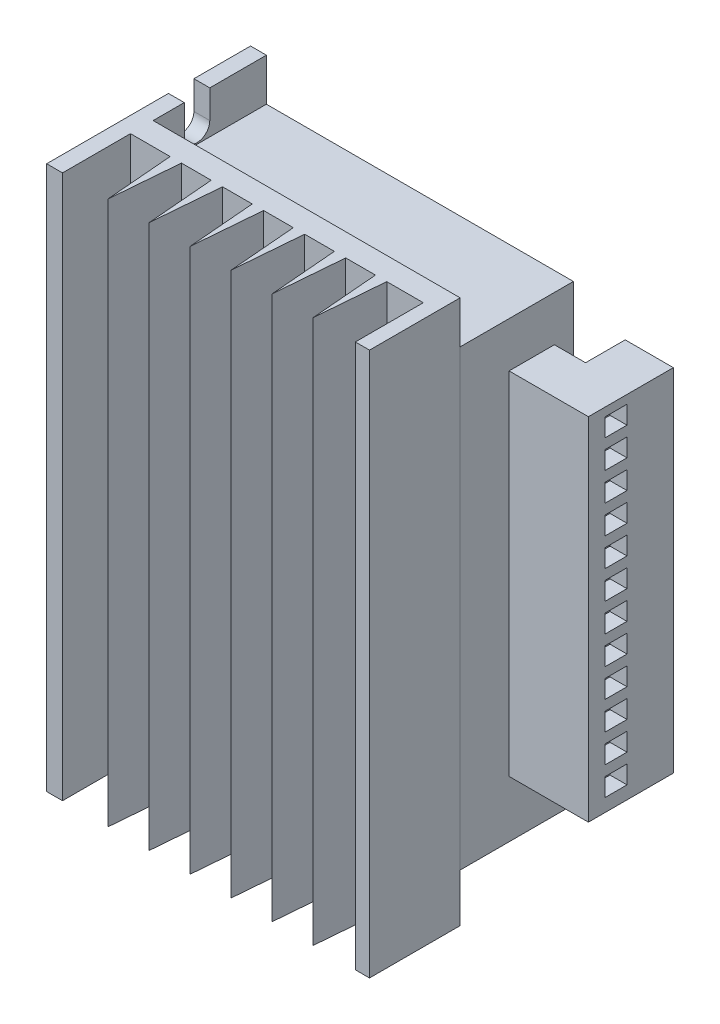
from build123d import *

# Parameters (mm, degrees)
BOSS_EXTRUDE1_DEPTH    = 96
SKETCH2_W              = 20
SKETCH2_H              = 80
BOSS_EXTRUDE2_DEPTH    = 54.2
CUT_EXTRUDE1_DEPTH     = 4
SKETCH9_W              = 8
SKETCH9_H              = 62
BOSS_EXTRUDE4_DEPTH    = 14
SKETCH10_W             = 15
SKETCH10_H             = 62
BOSS_EXTRUDE5_DEPTH    = 8.5
SKETCH11_R             = 1.6
CUT_EXTRUDE2_DEPTH     = 1
SKETCH13_R             = 1.508529724
BOSS_EXTRUDE6_DEPTH    = 0.5
BOSS_EXTRUDE6_2_DEPTH  = 0.5
BOSS_EXTRUDE6_3_DEPTH  = 0.5
BOSS_EXTRUDE6_4_DEPTH  = 0.5
BOSS_EXTRUDE6_5_DEPTH  = 0.5
BOSS_EXTRUDE6_6_DEPTH  = 0.5
BOSS_EXTRUDE6_7_DEPTH  = 0.5
BOSS_EXTRUDE6_8_DEPTH  = 0.5
BOSS_EXTRUDE6_9_DEPTH  = 0.5
BOSS_EXTRUDE6_10_DEPTH = 0.5
BOSS_EXTRUDE6_11_DEPTH = 0.5
BOSS_EXTRUDE6_12_DEPTH = 0.5
FILLET19_R             = 0.5
FILLET20_R             = 0.5
FILLET21_R             = 0.5
FILLET22_R             = 0.5
FILLET23_R             = 0.5
FILLET24_R             = 0.5
FILLET25_R             = 0.5
FILLET26_R             = 0.5
FILLET27_R             = 0.5
FILLET28_R             = 0.5
FILLET29_R             = 0.5
FILLET30_R             = 0.5
CUT_EXTRUDE4_DEPTH     = 0.25
SKETCH16_W             = 3.926204787
SKETCH16_H             = 3.2
CUT_EXTRUDE5_DEPTH     = 3


with BuildPart() as part:
    # Sketch1 → Boss-Extrude1 (new body)
    with BuildSketch(Plane(origin=(0, 0, 0), x_dir=(1, 0, 0), z_dir=(0, 1, 0))):
        Polygon((2.8, 16), (57, 16), (57, 0), (54.5, 0), (54.5, 12), (48.05, 12), (47.05, 0), (46.05, 12), (40.8, 12), (39.8, 0), (38.8, 12), (33.55, 12), (32.55, 0), (31.55, 12), (26.3, 12), (25.3, 0), (24.3, 12), (19.05, 12), (18.05, 0), (17.05, 12), (11.8, 12), (10.8, 0), (9.8, 12), (2.8, 12), (2.8, 0), (0, 0), (0, 36), (2.8, 36), align=None)
    extrude(amount=BOSS_EXTRUDE1_DEPTH)

    # Sketch8 → Cut-Extrude1 (cut)
    with BuildSketch(Plane(origin=(2.8, 0, 0), x_dir=(0, 0, -1), z_dir=(1, 0, 0))):
        with BuildLine():
            Line((26, 91), (26, 96))
            Line((26, 96), (21.5, 96))
            Line((21.5, 96), (21.5, 91))
            ThreePointArc((21.5, 91), (23.75, 88.75), (26, 91))
        make_face()
        with BuildLine():
            Line((21.5, 5), (21.5, 0))
            Line((21.5, 0), (26, 0))
            Line((26, 0), (26, 5))
            ThreePointArc((26, 5), (23.75, 7.25), (21.5, 5))
        make_face()
    extrude(amount=-CUT_EXTRUDE1_DEPTH, mode=Mode.SUBTRACT)


with BuildPart() as body_2:
    # Sketch2 → Boss-Extrude2 (new body)
    with BuildSketch(Plane(origin=(2.8, 0, 0), x_dir=(0, 0, -1), z_dir=(1, 0, 0))):
        with Locations((26, 48.5)):
            Rectangle(SKETCH2_W, SKETCH2_H)
    extrude(amount=BOSS_EXTRUDE2_DEPTH)


with BuildPart() as body_3:
    # Sketch9 → Boss-Extrude4 (new body)
    with BuildSketch(Plane(origin=(57, 0, 0), x_dir=(0, 0, -1), z_dir=(1, 0, 0))):
        with Locations((28.644699002, 49.5)):
            Rectangle(SKETCH9_W, SKETCH9_H)
    extrude(amount=BOSS_EXTRUDE4_DEPTH)

    # Sketch10 → Boss-Extrude5 (add)
    with BuildSketch(Plane(origin=(71, 0, 0), x_dir=(0, 0, -1), z_dir=(1, 0, 0))):
        with Locations((32.144699002, 49.5)):
            Rectangle(SKETCH10_W, SKETCH10_H)
    extrude(amount=-BOSS_EXTRUDE5_DEPTH)

    # Sketch11 → Cut-Extrude2 (cut)
    with BuildSketch(Plane(origin=(0, 0, -39.644699002), x_dir=(-1, 0, 0), z_dir=(0, 0, -1))):
        with Locations(Location((-66.124483919, 77.496806183, 0), (0, 0, 90))):
            Circle(SKETCH11_R)
        with Locations(Location((-66.124483919, 72.496806183, 0), (0, 0, 90))):
            Circle(SKETCH11_R)
        with Locations(Location((-66.124483919, 67.496806183, 0), (0, 0, 90))):
            Circle(SKETCH11_R)
        with Locations(Location((-66.124483919, 62.496806183, 0), (0, 0, 90))):
            Circle(SKETCH11_R)
        with Locations(Location((-66.124483919, 57.496806183, 0), (0, 0, 90))):
            Circle(SKETCH11_R)
        with Locations(Location((-66.124483919, 52.496806183, 0), (0, 0, 90))):
            Circle(SKETCH11_R)
        with Locations(Location((-66.124483919, 47.496806183, 0), (0, 0, 90))):
            Circle(SKETCH11_R)
        with Locations(Location((-66.124483919, 42.496806183, 0), (0, 0, 90))):
            Circle(SKETCH11_R)
        with Locations(Location((-66.124483919, 37.496806183, 0), (0, 0, 90))):
            Circle(SKETCH11_R)
        with Locations(Location((-66.124483919, 32.496806183, 0), (0, 0, 90))):
            Circle(SKETCH11_R)
        with Locations(Location((-66.124483919, 27.496806183, 0), (0, 0, 90))):
            Circle(SKETCH11_R)
        with Locations(Location((-66.124483919, 22.496806183, 0), (0, 0, 90))):
            Circle(SKETCH11_R)
    extrude(amount=-CUT_EXTRUDE2_DEPTH, mode=Mode.SUBTRACT)

    # Sketch16 → Cut-Extrude5 (cut)
    with BuildSketch(Plane(origin=(71, 0, 0), x_dir=(0, 0, -1), z_dir=(1, 0, 0))):
        with Locations((29.499003124, 77.4)):
            Rectangle(SKETCH16_W, SKETCH16_H)
        with Locations((29.499003124, 72.4)):
            Rectangle(SKETCH16_W, SKETCH16_H)
        with Locations((29.499003124, 67.4)):
            Rectangle(SKETCH16_W, SKETCH16_H)
        with Locations((29.499003124, 62.4)):
            Rectangle(SKETCH16_W, SKETCH16_H)
        with Locations((29.499003124, 57.4)):
            Rectangle(SKETCH16_W, SKETCH16_H)
        with Locations((29.499003124, 52.4)):
            Rectangle(SKETCH16_W, SKETCH16_H)
        with Locations((29.499003124, 47.4)):
            Rectangle(SKETCH16_W, SKETCH16_H)
        with Locations((29.499003124, 42.4)):
            Rectangle(SKETCH16_W, SKETCH16_H)
        with Locations((29.499003124, 37.4)):
            Rectangle(SKETCH16_W, SKETCH16_H)
        with Locations((29.499003124, 32.4)):
            Rectangle(SKETCH16_W, SKETCH16_H)
        with Locations((29.499003124, 27.4)):
            Rectangle(SKETCH16_W, SKETCH16_H)
        with Locations((29.499003124, 22.4)):
            Rectangle(SKETCH16_W, SKETCH16_H)
    extrude(amount=-CUT_EXTRUDE5_DEPTH, mode=Mode.SUBTRACT)


with BuildPart() as body_4:
    # Sketch13 → Boss-Extrude6 (new body)
    with BuildSketch(Plane(origin=(0, 0, -38.644699002), x_dir=(-1, 0, 0), z_dir=(0, 0, -1))):
        with Locations(Location((-66.124483919, 77.496806183, 0), (0, 0, 90))):
            Circle(SKETCH13_R)
    extrude(amount=BOSS_EXTRUDE6_DEPTH)

    # Fillet19
    fillet19_edges = [body_4.edges().sort_by_distance(p)[0] for p in [
        (66.124483919, 75.988276459, -39.144699002),
    ]]
    fillet(fillet19_edges, radius=FILLET19_R - 0.0001)  # a hair under: the kernel refuses the full size


with BuildPart() as body_5:
    # Sketch13 → Boss-Extrude6 2 (new body)
    with BuildSketch(Plane(origin=(0, 0, -38.644699002), x_dir=(-1, 0, 0), z_dir=(0, 0, -1))):
        with Locations(Location((-66.124483919, 72.496806183, 0), (0, 0, 90))):
            Circle(SKETCH13_R)
    extrude(amount=BOSS_EXTRUDE6_2_DEPTH)

    # Fillet20
    fillet20_edges = [body_5.edges().sort_by_distance(p)[0] for p in [
        (66.124483919, 70.988276459, -39.144699002),
    ]]
    fillet(fillet20_edges, radius=FILLET20_R - 0.0001)  # a hair under: the kernel refuses the full size


with BuildPart() as body_6:
    # Sketch13 → Boss-Extrude6 3 (new body)
    with BuildSketch(Plane(origin=(0, 0, -38.644699002), x_dir=(-1, 0, 0), z_dir=(0, 0, -1))):
        with Locations(Location((-66.124483919, 67.496806183, 0), (0, 0, 90))):
            Circle(SKETCH13_R)
    extrude(amount=BOSS_EXTRUDE6_3_DEPTH)

    # Fillet21
    fillet21_edges = [body_6.edges().sort_by_distance(p)[0] for p in [
        (66.124483919, 65.988276459, -39.144699002),
    ]]
    fillet(fillet21_edges, radius=FILLET21_R - 0.0001)  # a hair under: the kernel refuses the full size


with BuildPart() as body_7:
    # Sketch13 → Boss-Extrude6 4 (new body)
    with BuildSketch(Plane(origin=(0, 0, -38.644699002), x_dir=(-1, 0, 0), z_dir=(0, 0, -1))):
        with Locations(Location((-66.124483919, 62.496806183, 0), (0, 0, 90))):
            Circle(SKETCH13_R)
    extrude(amount=BOSS_EXTRUDE6_4_DEPTH)

    # Fillet22
    fillet22_edges = [body_7.edges().sort_by_distance(p)[0] for p in [
        (66.124483919, 60.988276459, -39.144699002),
    ]]
    fillet(fillet22_edges, radius=FILLET22_R - 0.0001)  # a hair under: the kernel refuses the full size


with BuildPart() as body_8:
    # Sketch13 → Boss-Extrude6 5 (new body)
    with BuildSketch(Plane(origin=(0, 0, -38.644699002), x_dir=(-1, 0, 0), z_dir=(0, 0, -1))):
        with Locations(Location((-66.124483919, 57.496806183, 0), (0, 0, 90))):
            Circle(SKETCH13_R)
    extrude(amount=BOSS_EXTRUDE6_5_DEPTH)

    # Fillet23
    fillet23_edges = [body_8.edges().sort_by_distance(p)[0] for p in [
        (66.124483919, 55.988276459, -39.144699002),
    ]]
    fillet(fillet23_edges, radius=FILLET23_R - 0.0001)  # a hair under: the kernel refuses the full size


with BuildPart() as body_9:
    # Sketch13 → Boss-Extrude6 6 (new body)
    with BuildSketch(Plane(origin=(0, 0, -38.644699002), x_dir=(-1, 0, 0), z_dir=(0, 0, -1))):
        with Locations(Location((-66.124483919, 52.496806183, 0), (0, 0, 90))):
            Circle(SKETCH13_R)
    extrude(amount=BOSS_EXTRUDE6_6_DEPTH)

    # Fillet24
    fillet24_edges = [body_9.edges().sort_by_distance(p)[0] for p in [
        (66.124483919, 50.988276459, -39.144699002),
    ]]
    fillet(fillet24_edges, radius=FILLET24_R - 0.0001)  # a hair under: the kernel refuses the full size


with BuildPart() as body_10:
    # Sketch13 → Boss-Extrude6 7 (new body)
    with BuildSketch(Plane(origin=(0, 0, -38.644699002), x_dir=(-1, 0, 0), z_dir=(0, 0, -1))):
        with Locations(Location((-66.124483919, 47.496806183, 0), (0, 0, 90))):
            Circle(SKETCH13_R)
    extrude(amount=BOSS_EXTRUDE6_7_DEPTH)

    # Fillet25
    fillet25_edges = [body_10.edges().sort_by_distance(p)[0] for p in [
        (66.124483919, 45.988276459, -39.144699002),
    ]]
    fillet(fillet25_edges, radius=FILLET25_R - 0.0001)  # a hair under: the kernel refuses the full size


with BuildPart() as body_11:
    # Sketch13 → Boss-Extrude6 8 (new body)
    with BuildSketch(Plane(origin=(0, 0, -38.644699002), x_dir=(-1, 0, 0), z_dir=(0, 0, -1))):
        with Locations(Location((-66.124483919, 42.496806183, 0), (0, 0, 90))):
            Circle(SKETCH13_R)
    extrude(amount=BOSS_EXTRUDE6_8_DEPTH)

    # Fillet26
    fillet26_edges = [body_11.edges().sort_by_distance(p)[0] for p in [
        (66.124483919, 40.988276459, -39.144699002),
    ]]
    fillet(fillet26_edges, radius=FILLET26_R - 0.0001)  # a hair under: the kernel refuses the full size


with BuildPart() as body_12:
    # Sketch13 → Boss-Extrude6 9 (new body)
    with BuildSketch(Plane(origin=(0, 0, -38.644699002), x_dir=(-1, 0, 0), z_dir=(0, 0, -1))):
        with Locations(Location((-66.124483919, 37.496806183, 0), (0, 0, 90))):
            Circle(SKETCH13_R)
    extrude(amount=BOSS_EXTRUDE6_9_DEPTH)

    # Fillet27
    fillet27_edges = [body_12.edges().sort_by_distance(p)[0] for p in [
        (66.124483919, 35.988276459, -39.144699002),
    ]]
    fillet(fillet27_edges, radius=FILLET27_R - 0.0001)  # a hair under: the kernel refuses the full size


with BuildPart() as body_13:
    # Sketch13 → Boss-Extrude6 10 (new body)
    with BuildSketch(Plane(origin=(0, 0, -38.644699002), x_dir=(-1, 0, 0), z_dir=(0, 0, -1))):
        with Locations(Location((-66.124483919, 32.496806183, 0), (0, 0, 90))):
            Circle(SKETCH13_R)
    extrude(amount=BOSS_EXTRUDE6_10_DEPTH)

    # Fillet28
    fillet28_edges = [body_13.edges().sort_by_distance(p)[0] for p in [
        (66.124483919, 30.988276459, -39.144699002),
    ]]
    fillet(fillet28_edges, radius=FILLET28_R - 0.0001)  # a hair under: the kernel refuses the full size


with BuildPart() as body_14:
    # Sketch13 → Boss-Extrude6 11 (new body)
    with BuildSketch(Plane(origin=(0, 0, -38.644699002), x_dir=(-1, 0, 0), z_dir=(0, 0, -1))):
        with Locations(Location((-66.124483919, 27.496806183, 0), (0, 0, 90))):
            Circle(SKETCH13_R)
    extrude(amount=BOSS_EXTRUDE6_11_DEPTH)

    # Fillet29
    fillet29_edges = [body_14.edges().sort_by_distance(p)[0] for p in [
        (66.124483919, 25.988276459, -39.144699002),
    ]]
    fillet(fillet29_edges, radius=FILLET29_R - 0.0001)  # a hair under: the kernel refuses the full size


with BuildPart() as body_15:
    # Sketch13 → Boss-Extrude6 12 (new body)
    with BuildSketch(Plane(origin=(0, 0, -38.644699002), x_dir=(-1, 0, 0), z_dir=(0, 0, -1))):
        with Locations(Location((-66.124483919, 22.496806183, 0), (0, 0, 90))):
            Circle(SKETCH13_R)
    extrude(amount=BOSS_EXTRUDE6_12_DEPTH)

    # Fillet30
    fillet30_edges = [body_15.edges().sort_by_distance(p)[0] for p in [
        (66.124483919, 20.988276459, -39.144699002),
    ]]
    fillet(fillet30_edges, radius=FILLET30_R - 0.0001)  # a hair under: the kernel refuses the full size


with BuildPart() as cut_extrude4_tool:
    # Sketch15 → Cut-Extrude4 (new body)
    with BuildSketch(Plane(origin=(0, 0, -39.144699002), x_dir=(-1, 0, 0), z_dir=(0, 0, -1))):
        with BuildLine():
            Line((-65.526657996, 71.121086674), (-66.236938048, 73.992584933))
            ThreePointArc((-66.236938048, 73.992584933), (-66.484661643, 73.952921565), (-66.722309842, 73.872525692))
            Line((-66.722309842, 73.872525692), (-66.012029791, 71.001027433))
            ThreePointArc((-66.012029791, 71.001027433), (-65.764306195, 71.040690801), (-65.526657996, 71.121086674))
        make_face()
        with BuildLine():
            Line((-65.526657996, 76.121086674), (-66.236938048, 78.992584933))
            ThreePointArc((-66.236938048, 78.992584933), (-66.484661643, 78.952921565), (-66.722309842, 78.872525692))
            Line((-66.722309842, 78.872525692), (-66.012029791, 76.001027433))
            ThreePointArc((-66.012029791, 76.001027433), (-65.764306195, 76.040690801), (-65.526657996, 76.121086674))
        make_face()
        with BuildLine():
            Line((-65.526657996, 66.121086674), (-66.236938048, 68.992584933))
            ThreePointArc((-66.236938048, 68.992584933), (-66.484661643, 68.952921565), (-66.722309842, 68.872525692))
            Line((-66.722309842, 68.872525692), (-66.012029791, 66.001027433))
            ThreePointArc((-66.012029791, 66.001027433), (-65.764306195, 66.040690801), (-65.526657996, 66.121086674))
        make_face()
        with BuildLine():
            Line((-65.526657996, 61.121086674), (-66.236938048, 63.992584933))
            ThreePointArc((-66.236938048, 63.992584933), (-66.484661643, 63.952921565), (-66.722309842, 63.872525692))
            Line((-66.722309842, 63.872525692), (-66.012029791, 61.001027433))
            ThreePointArc((-66.012029791, 61.001027433), (-65.764306195, 61.040690801), (-65.526657996, 61.121086674))
        make_face()
        with BuildLine():
            Line((-65.526657996, 56.121086674), (-66.236938048, 58.992584933))
            ThreePointArc((-66.236938048, 58.992584933), (-66.484661643, 58.952921565), (-66.722309842, 58.872525692))
            Line((-66.722309842, 58.872525692), (-66.012029791, 56.001027433))
            ThreePointArc((-66.012029791, 56.001027433), (-65.764306195, 56.040690801), (-65.526657996, 56.121086674))
        make_face()
        with BuildLine():
            Line((-65.526657996, 51.121086674), (-66.236938048, 53.992584933))
            ThreePointArc((-66.236938048, 53.992584933), (-66.484661643, 53.952921565), (-66.722309842, 53.872525692))
            Line((-66.722309842, 53.872525692), (-66.012029791, 51.001027433))
            ThreePointArc((-66.012029791, 51.001027433), (-65.764306195, 51.040690801), (-65.526657996, 51.121086674))
        make_face()
        with BuildLine():
            Line((-65.526657996, 46.121086674), (-66.236938048, 48.992584933))
            ThreePointArc((-66.236938048, 48.992584933), (-66.484661643, 48.952921565), (-66.722309842, 48.872525692))
            Line((-66.722309842, 48.872525692), (-66.012029791, 46.001027433))
            ThreePointArc((-66.012029791, 46.001027433), (-65.764306195, 46.040690801), (-65.526657996, 46.121086674))
        make_face()
        with BuildLine():
            Line((-65.526657996, 41.121086674), (-66.236938048, 43.992584933))
            ThreePointArc((-66.236938048, 43.992584933), (-66.484661643, 43.952921565), (-66.722309842, 43.872525692))
            Line((-66.722309842, 43.872525692), (-66.012029791, 41.001027433))
            ThreePointArc((-66.012029791, 41.001027433), (-65.764306195, 41.040690801), (-65.526657996, 41.121086674))
        make_face()
        with BuildLine():
            Line((-65.526657996, 36.121086674), (-66.236938048, 38.992584933))
            ThreePointArc((-66.236938048, 38.992584933), (-66.484661643, 38.952921565), (-66.722309842, 38.872525692))
            Line((-66.722309842, 38.872525692), (-66.012029791, 36.001027433))
            ThreePointArc((-66.012029791, 36.001027433), (-65.764306195, 36.040690801), (-65.526657996, 36.121086674))
        make_face()
        with BuildLine():
            Line((-65.526657996, 31.121086674), (-66.236938048, 33.992584933))
            ThreePointArc((-66.236938048, 33.992584933), (-66.484661643, 33.952921565), (-66.722309842, 33.872525692))
            Line((-66.722309842, 33.872525692), (-66.012029791, 31.001027433))
            ThreePointArc((-66.012029791, 31.001027433), (-65.764306195, 31.040690801), (-65.526657996, 31.121086674))
        make_face()
        with BuildLine():
            Line((-65.526657996, 26.121086674), (-66.236938048, 28.992584933))
            ThreePointArc((-66.236938048, 28.992584933), (-66.484661643, 28.952921565), (-66.722309842, 28.872525692))
            Line((-66.722309842, 28.872525692), (-66.012029791, 26.001027433))
            ThreePointArc((-66.012029791, 26.001027433), (-65.764306195, 26.040690801), (-65.526657996, 26.121086674))
        make_face()
        with BuildLine():
            Line((-65.526657996, 21.121086674), (-66.236938048, 23.992584933))
            ThreePointArc((-66.236938048, 23.992584933), (-66.484661643, 23.952921565), (-66.722309842, 23.872525692))
            Line((-66.722309842, 23.872525692), (-66.012029791, 21.001027433))
            ThreePointArc((-66.012029791, 21.001027433), (-65.764306195, 21.040690801), (-65.526657996, 21.121086674))
        make_face()
    extrude(amount=-CUT_EXTRUDE4_DEPTH)


with BuildPart() as body_4_1:
    add(body_4.part)

    # Cut-Extrude4: cut by cut_extrude4_tool
    add(cut_extrude4_tool.part, mode=Mode.SUBTRACT)


with BuildPart() as body_5_1:
    add(body_5.part)

    # Cut-Extrude4: cut by cut_extrude4_tool
    add(cut_extrude4_tool.part, mode=Mode.SUBTRACT)


with BuildPart() as body_6_1:
    add(body_6.part)

    # Cut-Extrude4: cut by cut_extrude4_tool
    add(cut_extrude4_tool.part, mode=Mode.SUBTRACT)


with BuildPart() as body_7_1:
    add(body_7.part)

    # Cut-Extrude4: cut by cut_extrude4_tool
    add(cut_extrude4_tool.part, mode=Mode.SUBTRACT)


with BuildPart() as body_8_1:
    add(body_8.part)

    # Cut-Extrude4: cut by cut_extrude4_tool
    add(cut_extrude4_tool.part, mode=Mode.SUBTRACT)


with BuildPart() as body_9_1:
    add(body_9.part)

    # Cut-Extrude4: cut by cut_extrude4_tool
    add(cut_extrude4_tool.part, mode=Mode.SUBTRACT)


with BuildPart() as body_10_1:
    add(body_10.part)

    # Cut-Extrude4: cut by cut_extrude4_tool
    add(cut_extrude4_tool.part, mode=Mode.SUBTRACT)


with BuildPart() as body_11_1:
    add(body_11.part)

    # Cut-Extrude4: cut by cut_extrude4_tool
    add(cut_extrude4_tool.part, mode=Mode.SUBTRACT)


with BuildPart() as body_12_1:
    add(body_12.part)

    # Cut-Extrude4: cut by cut_extrude4_tool
    add(cut_extrude4_tool.part, mode=Mode.SUBTRACT)


with BuildPart() as body_13_1:
    add(body_13.part)

    # Cut-Extrude4: cut by cut_extrude4_tool
    add(cut_extrude4_tool.part, mode=Mode.SUBTRACT)


with BuildPart() as body_14_1:
    add(body_14.part)

    # Cut-Extrude4: cut by cut_extrude4_tool
    add(cut_extrude4_tool.part, mode=Mode.SUBTRACT)


with BuildPart() as body_15_1:
    add(body_15.part)

    # Cut-Extrude4: cut by cut_extrude4_tool
    add(cut_extrude4_tool.part, mode=Mode.SUBTRACT)


solid = Compound([part.part, body_2.part, body_3.part, body_4_1.part, body_5_1.part, body_6_1.part, body_7_1.part, body_8_1.part, body_9_1.part, body_10_1.part, body_11_1.part, body_12_1.part, body_13_1.part, body_14_1.part, body_15_1.part])
